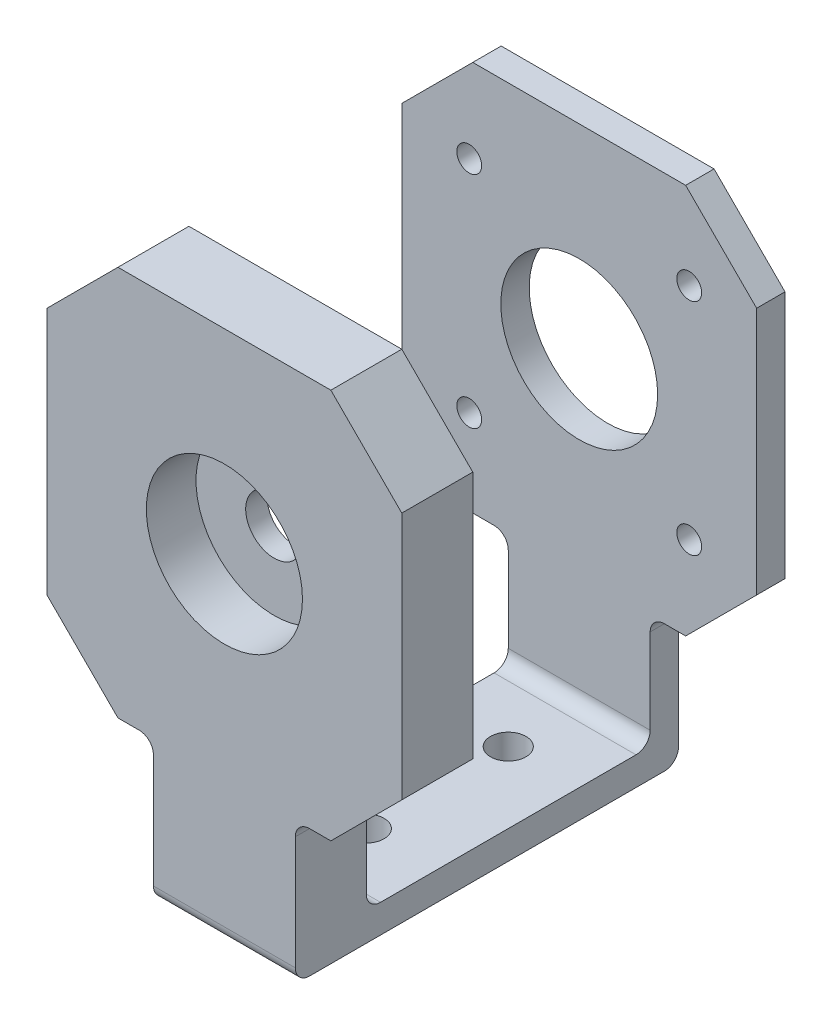
from build123d import *

# Parameters (mm, degrees)
SCHIZZO1_R                   = 1.75
SCHIZZO1_R_2                 = 11.05
ESTRUSIONE_ESTRUSIONE1_DEPTH = 4
SCHIZZO14_W                  = 20
SCHIZZO14_H                  = 4
ESTRUSIONE_ESTRUSIONE2_DEPTH = 40
ESTRUSIONE_ESTRUSIONE3_DEPTH = 10
SCHIZZO19_R                  = 11
TAGLIO_ESTRUSIONE1_DEPTH     = 7
SCHIZZO20_R                  = 4
TAGLIO_ESTRUSIONE2_DEPTH     = 7
SMUSSO1_SIZE                 = 10
RACCORDO1_R                  = 2
SCHIZZO21_R                  = 2.5
TAGLIO_ESTRUSIONE3_DEPTH     = 10


with BuildPart() as part:
    # Schizzo1 → Estrusione-Estrusione1 (new body)
    with BuildSketch(Plane.XY):
        Polygon((-25, -27.5), (-10, -27.5), (-10, -47.5), (10, -47.5), (10, -27.5), (25, -27.5), (25, 27.5), (-25, 27.5), align=None)
        with Locations((-15.5, 15.5)):
            Circle(SCHIZZO1_R, mode=Mode.SUBTRACT)
        with Locations((15.5, 15.5)):
            Circle(SCHIZZO1_R, mode=Mode.SUBTRACT)
        with Locations((15.5, -15.5)):
            Circle(SCHIZZO1_R, mode=Mode.SUBTRACT)
        with Locations((-15.5, -15.5)):
            Circle(SCHIZZO1_R, mode=Mode.SUBTRACT)
        Circle(SCHIZZO1_R_2, mode=Mode.SUBTRACT)
    extrude(amount=ESTRUSIONE_ESTRUSIONE1_DEPTH)

    # Schizzo14 → Estrusione-Estrusione2 (add)
    with BuildSketch(Plane.XY.offset(4)):
        with Locations((0, -45.5)):
            Rectangle(SCHIZZO14_W, SCHIZZO14_H)
    extrude(amount=ESTRUSIONE_ESTRUSIONE2_DEPTH)

    # Schizzo18 → Estrusione-Estrusione3 (add)
    with BuildSketch(Plane.XY.offset(44)):
        Polygon((-25, -27.5), (-10, -27.5), (-10, -47.5), (10, -47.5), (10, -27.5), (25, -27.5), (25, 27.5), (-25, 27.5), align=None)
    extrude(amount=ESTRUSIONE_ESTRUSIONE3_DEPTH)

    # Schizzo19 → Taglio-Estrusione1 (cut)
    with BuildSketch(Plane.XY.offset(54)):
        Circle(SCHIZZO19_R)
    extrude(amount=-TAGLIO_ESTRUSIONE1_DEPTH, mode=Mode.SUBTRACT)

    # Schizzo20 → Taglio-Estrusione2 (cut)
    with BuildSketch(Plane.XY.offset(47)):
        Circle(SCHIZZO20_R)
    extrude(amount=-TAGLIO_ESTRUSIONE2_DEPTH, mode=Mode.SUBTRACT)

    # Smusso1
    smusso1_edges = [part.edges().sort_by_distance(p)[0] for p in [
        (25, 27.5, 2),
        (25, -27.5, 2),
        (-25, -27.5, 2),
        (-25, 27.5, 2),
        (25, -27.5, 49),
        (-25, -27.5, 49),
        (-25, 27.5, 49),
        (25, 27.5, 49),
    ]]
    chamfer(smusso1_edges, length=SMUSSO1_SIZE)

    # Raccordo1
    raccordo1_edges = [part.edges().sort_by_distance(p)[0] for p in [
        (0, -47.5, 0),
        (-10, -27.5, 2),
        (10, -27.5, 2),
        (0, -43.5, 4),
        (0, -43.5, 44),
        (0, -47.5, 54),
        (-10, -27.5, 49),
        (10, -27.5, 49),
    ]]
    fillet(raccordo1_edges, radius=RACCORDO1_R)

    # Schizzo21 → Taglio-Estrusione3 (cut)
    with BuildSketch(Plane(origin=(0, -43.5, 0), x_dir=(1, 0, 0), z_dir=(0, 1, 0))):
        with Locations((0, -14)):
            Circle(SCHIZZO21_R)
        with Locations((0, -34)):
            Circle(SCHIZZO21_R)
    extrude(amount=-TAGLIO_ESTRUSIONE3_DEPTH, mode=Mode.SUBTRACT)


solid = part.part
